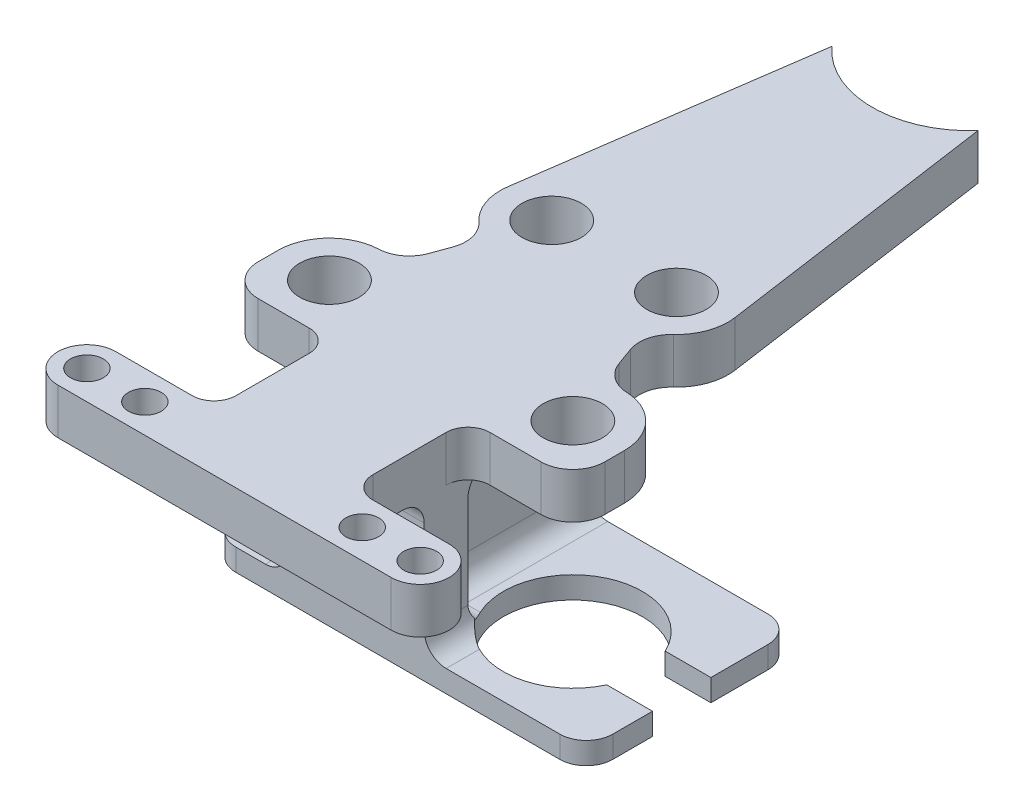
from build123d import *

# Parameters (mm, degrees)
SKETCH1_R           = 3.25
BOSS_EXTRUDE1_DEPTH = 5
SKETCH3_R           = 1.7
BOSS_EXTRUDE2_DEPTH = 2.4
BOSS_EXTRUDE3_REACH = 66.855
SKETCH5_R           = 1.8
BOSS_EXTRUDE4_DEPTH = 5
FILLET1_R           = 2.4
FILLET2_R           = 2.4


with BuildPart() as part:
    # Sketch1 → Boss-Extrude1 (new body)
    with BuildSketch(Plane(origin=(0, 0, 0), x_dir=(1, 0, 0), z_dir=(0, 1, 0))):
        with BuildLine():
            Line((10.443513484, 13.59429391), (9.728103792, 15.559865885))
            ThreePointArc((9.728103792, 15.559865885), (9.617407167, 17.589149357), (10.652936445, 19.337841515))
            ThreePointArc((10.652936445, 19.337841515), (12.155980837, 21.599725149), (12.430058531, 24.30160254))
            Line((12.430058531, 24.30160254), (8, 55.375021057))
            ThreePointArc((8, 55.375021057), (0, 51.788534795), (-8, 55.375021057))
            Line((-8, 55.375021057), (-12.430058531, 24.30160254))
            ThreePointArc((-12.430058531, 24.30160254), (-12.155980837, 21.599725149), (-10.652936445, 19.337841515))
            ThreePointArc((-10.652936445, 19.337841515), (-9.617407167, 17.589149357), (-9.728103792, 15.559865885))
            Line((-9.728103792, 15.559865885), (-10.443513484, 13.59429391))
            ThreePointArc((-10.443513484, 13.59429391), (-11.663113222, 11.968618164), (-13.580412324, 11.294667642))
            ThreePointArc((-13.580412324, 11.294667642), (-17.415997404, 9.557423727), (-18.985, 5.65))
            Line((-18.985, 5.65), (-18.985, 3.5))
            ThreePointArc((-18.985, 3.5), (-17.959873734, 1.025126266), (-15.485, 0))
            Line((-15.485, 0), (15.485, 0))
            ThreePointArc((15.485, 0), (17.959873734, 1.025126266), (18.985, 3.5))
            Line((18.985, 3.5), (18.985, 5.65))
            ThreePointArc((18.985, 5.65), (17.415997404, 9.557423727), (13.580412324, 11.294667642))
            ThreePointArc((13.580412324, 11.294667642), (11.663113222, 11.968618164), (10.443513484, 13.59429391))
        make_face()
        with Locations(Location((6.836617277, 23.504159795, 0), (0, 0, 270))):
            Circle(SKETCH1_R, mode=Mode.SUBTRACT)
        with Locations(Location((13.335, 5.65, 0), (0, 0, 270))):
            Circle(SKETCH1_R, mode=Mode.SUBTRACT)
        with Locations(Location((-13.335, 5.65, 0), (0, 0, 90))):
            Circle(SKETCH1_R, mode=Mode.SUBTRACT)
        with Locations(Location((-6.836617277, 23.504159795, 0), (0, 0, 90))):
            Circle(SKETCH1_R, mode=Mode.SUBTRACT)
    extrude(amount=BOSS_EXTRUDE1_DEPTH)

    # Boss-Extrude3: up to this face of the body (flat: up to its plane)
    boss_extrude3_end = Plane(part.part.faces().sort_by_distance((0, 5, -24.11358482))[0])
    # Sketch4 → Boss-Extrude3 (add, up to the picked face)
    with BuildSketch(Plane.XZ.offset(17.4), mode=Mode.PRIVATE) as boss_extrude3_sk1:
        Polygon((-2.4, 0), (-2.4, -18), (2.4, -18), (2.4, 0), (7.5, 0), (7.5, 4.8), (-7.5, 4.8), (-7.5, 0), align=None)
    boss_extrude3_tool1 = split(extrude(boss_extrude3_sk1.sketch, amount=-BOSS_EXTRUDE3_REACH, mode=Mode.PRIVATE), bisect_by=boss_extrude3_end, keep=Keep.BOTH, mode=Mode.PRIVATE)


with BuildPart() as body_2:
    # Sketch3 → Boss-Extrude2 (new body)
    with BuildSketch(Plane(origin=(0, -15, 0), x_dir=(-1, 0, 0), z_dir=(0, -1, 0))):
        with BuildLine():
            Line((13.14, -4.8), (-22.36, -4.8))
            ThreePointArc((-22.36, -4.8), (-24.410609665, -3.950609665), (-25.26, -1.9))
            Line((-25.26, -1.9), (-25.26, 2.45))
            Line((-25.26, 2.45), (-20.25051878, 2.45))
            ThreePointArc((-20.25051878, 2.45), (-5.715, 5.65), (-20.25051878, 8.85))
            Line((-20.25051878, 8.85), (-25.26, 8.85))
            Line((-25.26, 8.85), (-25.26, 15.1))
            ThreePointArc((-25.26, 15.1), (-24.410609665, 17.150609665), (-22.36, 18))
            Line((-22.36, 18), (-13.335, 18))
            Line((-13.335, 18), (7.22, 18))
            ThreePointArc((7.22, 18), (9.313036072, 17.133036072), (10.18, 15.04))
            ThreePointArc((10.18, 15.04), (11.046963928, 12.946963928), (13.14, 12.08))
            ThreePointArc((13.14, 12.08), (15.190609665, 11.230609665), (16.04, 9.18))
            Line((16.04, 9.18), (16.04, -1.9))
            ThreePointArc((16.04, -1.9), (15.190609665, -3.950609665), (13.14, -4.8))
        make_face()
        with Locations(Location((13.14, 5.65, 0), (0, 0, 90))):
            Circle(SKETCH3_R, mode=Mode.SUBTRACT)
    extrude(amount=BOSS_EXTRUDE2_DEPTH)


with BuildPart() as part_1:
    add(part.part)

    add(body_2.part)  # Boss-Extrude3 merges body 2
    add(boss_extrude3_tool1.solids().sort_by(Axis((0, -17.4, -3.818182), (0, 1, 0)))[0])

    # Sketch5 → Boss-Extrude4 (add)
    with BuildSketch(Plane(origin=(0, 5, 0), x_dir=(1, 0, 0), z_dir=(0, 1, 0))):
        with BuildLine():
            Line((7.5, -12.825), (18.25625, -12.825))
            ThreePointArc((18.25625, -12.825), (21.43125, -16), (18.25625, -19.175))
            Line((18.25625, -19.175), (-18.25625, -19.175))
            ThreePointArc((-18.25625, -19.175), (-21.43125, -16), (-18.25625, -12.825))
            Line((-18.25625, -12.825), (-7.5, -12.825))
            Line((-7.5, -12.825), (-7.5, -4.8))
            Line((-7.5, -4.8), (7.5, -4.8))
            Line((7.5, -4.8), (7.5, -12.825))
        make_face()
        with Locations(Location((18.25625, -16, 0), (0, 0, 270))):
            Circle(SKETCH5_R, mode=Mode.SUBTRACT)
        with Locations(Location((11.90625, -16, 0), (0, 0, 270))):
            Circle(SKETCH5_R, mode=Mode.SUBTRACT)
        with Locations(Location((-11.90625, -16, 0), (0, 0, 270))):
            Circle(SKETCH5_R, mode=Mode.SUBTRACT)
        with Locations(Location((-18.25625, -16, 0), (0, 0, 270))):
            Circle(SKETCH5_R, mode=Mode.SUBTRACT)
    extrude(amount=-BOSS_EXTRUDE4_DEPTH)

    # Fillet1
    # the kernel refuses this fillet: 2.4 mm, written as the material it adds along each edge
    with BuildSketch(Plane(origin=(-4.8, -12.6, -2.4), x_dir=(1, 0, 0), z_dir=(0, -1, 0))) as fillet1_piece_1_section:
        Polygon((0, 0), (FILLET1_R * 1.02, 0), (FILLET1_R * 1.02, FILLET1_R * 1.02), (0, FILLET1_R * 1.02), align=None)
    fillet1_piece_1 = extrude(amount=FILLET1_R * 1.02, mode=Mode.PRIVATE)
    fillet1_piece_1 = fillet1_piece_1 - Plane(origin=(-4.8, -12.6, -2.4), x_dir=(-0.7071067811865477, 0, -0.7071067811865474), z_dir=(0, -1, 0)) * Sphere(FILLET1_R, mode=Mode.PRIVATE)
    add(fillet1_piece_1)
    with BuildSketch(Plane(origin=(4.8, -12.6, -2.4), x_dir=(0, 0, 1), z_dir=(-1, 0, 0))) as fillet1_piece_2_section:
        Polygon((0, 0), (FILLET1_R * 1.02, 0), (FILLET1_R * 1.02, -FILLET1_R * 1.02), (0, -FILLET1_R * 1.02), align=None)
    fillet1_piece_2 = extrude(amount=FILLET1_R * 1.02, mode=Mode.PRIVATE)
    fillet1_piece_2 = fillet1_piece_2 - Plane(origin=(4.8, -12.6, -2.4), x_dir=(0, 0.7071067811865475, -0.7071067811865475), z_dir=(-1, 0, 0)) * Sphere(FILLET1_R, mode=Mode.PRIVATE)
    add(fillet1_piece_2)
    with BuildSketch(Plane(origin=(2.4, 0, 0), x_dir=(1, 0, 0), z_dir=(0, 0, -1)), Plane(origin=(-2.4, 0, -18), x_dir=(-1, 0, 0), z_dir=(0, 0, 1))) as fillet1_piece_3:
        with BuildLine():
            CenterArc((FILLET1_R, FILLET1_R), FILLET1_R, 180, 90)
            Line((0, FILLET1_R), (-FILLET1_R * 0.02, FILLET1_R))
            Line((-FILLET1_R * 0.02, FILLET1_R), (-FILLET1_R * 0.02, -FILLET1_R * 0.02))
            Line((-FILLET1_R * 0.02, -FILLET1_R * 0.02), (FILLET1_R, -FILLET1_R * 0.02))
            Line((FILLET1_R, -FILLET1_R * 0.02), (FILLET1_R, 0))
        make_face()
    extrude(amount=18)
    with BuildSketch(Plane(origin=(-2.4, -12.6, 0), x_dir=(-1, 0, 0), z_dir=(0, 1, 0)), Plane(origin=(2.4, -12.6, 0), x_dir=(0, 0, -1), z_dir=(0, 1, 0))) as fillet1_piece_4:
        with BuildLine():
            CenterArc((FILLET1_R, -FILLET1_R), FILLET1_R, 90, 90)
            Line((0, -FILLET1_R), (-FILLET1_R * 0.02, -FILLET1_R))
            Line((-FILLET1_R * 0.02, -FILLET1_R), (-FILLET1_R * 0.02, FILLET1_R * 0.02))
            Line((-FILLET1_R * 0.02, FILLET1_R * 0.02), (FILLET1_R, FILLET1_R * 0.02))
            Line((FILLET1_R, FILLET1_R * 0.02), (FILLET1_R, 0))
        make_face()
    extrude(amount=12.6)
    with BuildSketch(Plane(origin=(-7.5, 0, 0), x_dir=(-1, 0, 0), z_dir=(0, 1, 0))) as fillet1_piece_5_section:
        with BuildLine():
            CenterArc((FILLET1_R, FILLET1_R), FILLET1_R, 180, 90)
            Line((0, FILLET1_R), (-FILLET1_R * 0.02, FILLET1_R))
            Line((-FILLET1_R * 0.02, FILLET1_R), (-FILLET1_R * 0.02, -FILLET1_R * 0.02))
            Line((-FILLET1_R * 0.02, -FILLET1_R * 0.02), (FILLET1_R, -FILLET1_R * 0.02))
            Line((FILLET1_R, -FILLET1_R * 0.02), (FILLET1_R, 0))
        make_face()
    fillet1_piece_5 = extrude(amount=5, mode=Mode.PRIVATE)
    fillet1_piece_5 = split(fillet1_piece_5, bisect_by=Plane(origin=(-7.988335511, 2.5, 0), z_dir=(0, 0, 1)), keep=Keep.TOP, mode=Mode.PRIVATE)
    add(fillet1_piece_5)
    with BuildSketch(Plane(origin=(7.5, 5, 12.825), x_dir=(1, 0, 0), z_dir=(0, -1, 0))) as fillet1_piece_6:
        with BuildLine():
            CenterArc((FILLET1_R, -FILLET1_R), FILLET1_R, 90, 90)
            Line((0, -FILLET1_R), (-FILLET1_R * 0.02, -FILLET1_R))
            Line((-FILLET1_R * 0.02, -FILLET1_R), (-FILLET1_R * 0.02, FILLET1_R * 0.02))
            Line((-FILLET1_R * 0.02, FILLET1_R * 0.02), (FILLET1_R, FILLET1_R * 0.02))
            Line((FILLET1_R, FILLET1_R * 0.02), (FILLET1_R, 0))
        make_face()
    extrude(amount=5)
    with BuildSketch(Plane(origin=(7.5, 0, 0), x_dir=(1, 0, 0), z_dir=(0, 1, 0))) as fillet1_piece_7_section:
        with BuildLine():
            CenterArc((FILLET1_R, -FILLET1_R), FILLET1_R, 90, 90)
            Line((0, -FILLET1_R), (-FILLET1_R * 0.02, -FILLET1_R))
            Line((-FILLET1_R * 0.02, -FILLET1_R), (-FILLET1_R * 0.02, FILLET1_R * 0.02))
            Line((-FILLET1_R * 0.02, FILLET1_R * 0.02), (FILLET1_R, FILLET1_R * 0.02))
            Line((FILLET1_R, FILLET1_R * 0.02), (FILLET1_R, 0))
        make_face()
    fillet1_piece_7 = extrude(amount=5, mode=Mode.PRIVATE)
    fillet1_piece_7 = split(fillet1_piece_7, bisect_by=Plane(origin=(7.988335511, 2.5, 0), z_dir=(0, 0, 1)), keep=Keep.TOP, mode=Mode.PRIVATE)
    add(fillet1_piece_7)
    with BuildSketch(Plane(origin=(-7.5, 5, 12.825), x_dir=(-1, 0, 0), z_dir=(0, -1, 0))) as fillet1_piece_8:
        with BuildLine():
            CenterArc((FILLET1_R, FILLET1_R), FILLET1_R, 180, 90)
            Line((0, FILLET1_R), (-FILLET1_R * 0.02, FILLET1_R))
            Line((-FILLET1_R * 0.02, FILLET1_R), (-FILLET1_R * 0.02, -FILLET1_R * 0.02))
            Line((-FILLET1_R * 0.02, -FILLET1_R * 0.02), (FILLET1_R, -FILLET1_R * 0.02))
            Line((FILLET1_R, -FILLET1_R * 0.02), (FILLET1_R, 0))
        make_face()
    extrude(amount=5)
    with BuildSketch(Plane(origin=(2.4, -15, -2.4), x_dir=(1, 0, 0), z_dir=(0, 0, -1))) as fillet1_piece_9:
        with BuildLine():
            CenterArc((FILLET1_R, -FILLET1_R), FILLET1_R, 90, 90)
            Line((0, -FILLET1_R), (-FILLET1_R * 0.02, -FILLET1_R))
            Line((-FILLET1_R * 0.02, -FILLET1_R), (-FILLET1_R * 0.02, FILLET1_R * 0.02))
            Line((-FILLET1_R * 0.02, FILLET1_R * 0.02), (FILLET1_R, FILLET1_R * 0.02))
            Line((FILLET1_R, FILLET1_R * 0.02), (FILLET1_R, 0))
        make_face()
    extrude(amount=15.6)
    with BuildSketch(Plane(origin=(-7.5, -15, 0), x_dir=(0, 1, 0), z_dir=(0, 0, 1))) as fillet1_piece_10:
        with BuildLine():
            CenterArc((FILLET1_R, FILLET1_R), FILLET1_R, 180, 90)
            Line((0, FILLET1_R), (-FILLET1_R * 0.02, FILLET1_R))
            Line((-FILLET1_R * 0.02, FILLET1_R), (-FILLET1_R * 0.02, -FILLET1_R * 0.02))
            Line((-FILLET1_R * 0.02, -FILLET1_R * 0.02), (FILLET1_R, -FILLET1_R * 0.02))
            Line((FILLET1_R, -FILLET1_R * 0.02), (FILLET1_R, 0))
        make_face()
    extrude(amount=4.8)
    with BuildSketch(Plane(origin=(-2.4, -15, -18), x_dir=(0, 1, 0), z_dir=(0, 0, 1))) as fillet1_piece_11:
        with BuildLine():
            CenterArc((FILLET1_R, FILLET1_R), FILLET1_R, 180, 90)
            Line((0, FILLET1_R), (-FILLET1_R * 0.02, FILLET1_R))
            Line((-FILLET1_R * 0.02, FILLET1_R), (-FILLET1_R * 0.02, -FILLET1_R * 0.02))
            Line((-FILLET1_R * 0.02, -FILLET1_R * 0.02), (FILLET1_R, -FILLET1_R * 0.02))
            Line((FILLET1_R, -FILLET1_R * 0.02), (FILLET1_R, 0))
        make_face()
    extrude(amount=15.6)
    with BuildSketch(Plane(origin=(-4.8, -15, 0), x_dir=(0, 1, 0), z_dir=(-1, 0, 0))) as fillet1_piece_12:
        with BuildLine():
            CenterArc((FILLET1_R, FILLET1_R), FILLET1_R, 180, 90)
            Line((0, FILLET1_R), (-FILLET1_R * 0.02, FILLET1_R))
            Line((-FILLET1_R * 0.02, FILLET1_R), (-FILLET1_R * 0.02, -FILLET1_R * 0.02))
            Line((-FILLET1_R * 0.02, -FILLET1_R * 0.02), (FILLET1_R, -FILLET1_R * 0.02))
            Line((FILLET1_R, -FILLET1_R * 0.02), (FILLET1_R, 0))
        make_face()
    extrude(amount=2.7)
    with BuildSketch(Plane(origin=(7.5, -15, 0), x_dir=(0, 0, -1), z_dir=(-1, 0, 0))) as fillet1_piece_13_section:
        with BuildLine():
            CenterArc((FILLET1_R, -FILLET1_R), FILLET1_R, 90, 90)
            Line((0, -FILLET1_R), (-FILLET1_R * 0.02, -FILLET1_R))
            Line((-FILLET1_R * 0.02, -FILLET1_R), (-FILLET1_R * 0.02, FILLET1_R * 0.02))
            Line((-FILLET1_R * 0.02, FILLET1_R * 0.02), (FILLET1_R, FILLET1_R * 0.02))
            Line((FILLET1_R, FILLET1_R * 0.02), (FILLET1_R, 0))
        make_face()
    fillet1_piece_13 = extrude(amount=2.7, mode=Mode.PRIVATE)
    fillet1_piece_13 = fillet1_piece_13 - Plane(origin=(13.335, -14.438694291, -5.65), x_dir=(0.9075483963583585, 0, 0.4199475065616797), z_dir=(0, 1, 0)) * Cylinder(7.62, 16, mode=Mode.PRIVATE)
    add(fillet1_piece_13)
    with BuildSketch(Plane(origin=(2.4, 0, 6), x_dir=(1, 0, 0), z_dir=(0, 0, -1))) as fillet1_piece_14a_section:
        with BuildLine():
            CenterArc((FILLET1_R, FILLET1_R), FILLET1_R, 180, 90)
            Line((0, FILLET1_R), (-FILLET1_R * 0.02, FILLET1_R))
            Line((-FILLET1_R * 0.02, FILLET1_R), (-FILLET1_R * 0.02, -FILLET1_R * 0.02))
            Line((-FILLET1_R * 0.02, -FILLET1_R * 0.02), (FILLET1_R, -FILLET1_R * 0.02))
            Line((FILLET1_R, -FILLET1_R * 0.02), (FILLET1_R, 0))
        make_face()
    fillet1_piece_14a = extrude(amount=24, mode=Mode.PRIVATE)
    fillet1_piece_14a = split(fillet1_piece_14a, bisect_by=Plane(origin=(2.943348274, -0.543348274, 0), z_dir=(0, 0, 1)), keep=Keep.TOP, mode=Mode.PRIVATE)
    with BuildSketch(Plane(origin=(2.4, -12.6, 0), x_dir=(0, 0, -1), z_dir=(0, 1, 0))) as fillet1_piece_14b_section:
        with BuildLine():
            CenterArc((FILLET1_R, -FILLET1_R), FILLET1_R, 90, 90)
            Line((0, -FILLET1_R), (-FILLET1_R * 0.02, -FILLET1_R))
            Line((-FILLET1_R * 0.02, -FILLET1_R), (-FILLET1_R * 0.02, FILLET1_R * 0.02))
            Line((-FILLET1_R * 0.02, FILLET1_R * 0.02), (FILLET1_R, FILLET1_R * 0.02))
            Line((FILLET1_R, FILLET1_R * 0.02), (FILLET1_R, 0))
        make_face()
    fillet1_piece_14b = extrude(amount=18.6, mode=Mode.PRIVATE)
    fillet1_piece_14b = split(fillet1_piece_14b, bisect_by=Plane(origin=(2.943348274, 0, -0.543348274), z_dir=(0, 1, 0)), keep=Keep.TOP, mode=Mode.PRIVATE)
    fillet1_piece_14 = fillet1_piece_14a & fillet1_piece_14b
    add(fillet1_piece_14)
    with BuildSketch(Plane(origin=(-2.4, 0, -18), x_dir=(-1, 0, 0), z_dir=(0, 0, 1))) as fillet1_piece_15a_section:
        with BuildLine():
            CenterArc((FILLET1_R, FILLET1_R), FILLET1_R, 180, 90)
            Line((0, FILLET1_R), (-FILLET1_R * 0.02, FILLET1_R))
            Line((-FILLET1_R * 0.02, FILLET1_R), (-FILLET1_R * 0.02, -FILLET1_R * 0.02))
            Line((-FILLET1_R * 0.02, -FILLET1_R * 0.02), (FILLET1_R, -FILLET1_R * 0.02))
            Line((FILLET1_R, -FILLET1_R * 0.02), (FILLET1_R, 0))
        make_face()
    fillet1_piece_15a = extrude(amount=24, mode=Mode.PRIVATE)
    fillet1_piece_15a = split(fillet1_piece_15a, bisect_by=Plane(origin=(-2.943348274, -0.543348274, 0), z_dir=(0, 0, 1)), keep=Keep.TOP, mode=Mode.PRIVATE)
    with BuildSketch(Plane(origin=(-2.4, -12.6, 0), x_dir=(-1, 0, 0), z_dir=(0, 1, 0))) as fillet1_piece_15b_section:
        with BuildLine():
            CenterArc((FILLET1_R, -FILLET1_R), FILLET1_R, 90, 90)
            Line((0, -FILLET1_R), (-FILLET1_R * 0.02, -FILLET1_R))
            Line((-FILLET1_R * 0.02, -FILLET1_R), (-FILLET1_R * 0.02, FILLET1_R * 0.02))
            Line((-FILLET1_R * 0.02, FILLET1_R * 0.02), (FILLET1_R, FILLET1_R * 0.02))
            Line((FILLET1_R, FILLET1_R * 0.02), (FILLET1_R, 0))
        make_face()
    fillet1_piece_15b = extrude(amount=18.6, mode=Mode.PRIVATE)
    fillet1_piece_15b = split(fillet1_piece_15b, bisect_by=Plane(origin=(-2.943348274, 0, -0.543348274), z_dir=(0, 1, 0)), keep=Keep.TOP, mode=Mode.PRIVATE)
    fillet1_piece_15 = fillet1_piece_15a & fillet1_piece_15b
    add(fillet1_piece_15)
    with BuildSketch(Plane(origin=(-4.8, -15, 0), x_dir=(0, 1, 0), z_dir=(-1, 0, 0))) as fillet1_piece_16a_section:
        with BuildLine():
            CenterArc((FILLET1_R, FILLET1_R), FILLET1_R, 180, 90)
            Line((0, FILLET1_R), (-FILLET1_R * 0.02, FILLET1_R))
            Line((-FILLET1_R * 0.02, FILLET1_R), (-FILLET1_R * 0.02, -FILLET1_R * 0.02))
            Line((-FILLET1_R * 0.02, -FILLET1_R * 0.02), (FILLET1_R, -FILLET1_R * 0.02))
            Line((FILLET1_R, -FILLET1_R * 0.02), (FILLET1_R, 0))
        make_face()
    fillet1_piece_16a = extrude(amount=8.7, mode=Mode.PRIVATE)
    fillet1_piece_16a = split(fillet1_piece_16a, bisect_by=Plane(origin=(-7.5, -14.456651726, -0.543348274), z_dir=(-1, 0, 0)), keep=Keep.TOP, mode=Mode.PRIVATE)
    with BuildSketch(Plane(origin=(-7.5, -15, -6), x_dir=(0, 1, 0), z_dir=(0, 0, 1))) as fillet1_piece_16b_section:
        with BuildLine():
            CenterArc((FILLET1_R, FILLET1_R), FILLET1_R, 180, 90)
            Line((0, FILLET1_R), (-FILLET1_R * 0.02, FILLET1_R))
            Line((-FILLET1_R * 0.02, FILLET1_R), (-FILLET1_R * 0.02, -FILLET1_R * 0.02))
            Line((-FILLET1_R * 0.02, -FILLET1_R * 0.02), (FILLET1_R, -FILLET1_R * 0.02))
            Line((FILLET1_R, -FILLET1_R * 0.02), (FILLET1_R, 0))
        make_face()
    fillet1_piece_16b = extrude(amount=10.8, mode=Mode.PRIVATE)
    fillet1_piece_16b = split(fillet1_piece_16b, bisect_by=Plane(origin=(-8.043348274, -14.456651726, 0), z_dir=(0, 0, -1)), keep=Keep.TOP, mode=Mode.PRIVATE)
    fillet1_piece_16 = fillet1_piece_16a & fillet1_piece_16b
    add(fillet1_piece_16)

    # Fillet2
    # the kernel refuses this fillet: 2.4 mm, written as the material it adds along each edge
    with BuildSketch(Plane(origin=(4.8, -2.4, -2.4), x_dir=(0, 0, 1), z_dir=(0, 1, 0))) as fillet2_piece_1_section:
        Polygon((0, 0), (FILLET2_R * 1.02, 0), (FILLET2_R * 1.02, -FILLET2_R * 1.02), (0, -FILLET2_R * 1.02), align=None)
    fillet2_piece_1 = extrude(amount=FILLET2_R * 1.02, mode=Mode.PRIVATE)
    fillet2_piece_1 = fillet2_piece_1 - Plane(origin=(4.8, -2.4, -2.4), x_dir=(0.7071067811865479, 0, -0.7071067811865471), z_dir=(0, 1, 0)) * Sphere(FILLET2_R, mode=Mode.PRIVATE)
    add(fillet2_piece_1)
    with BuildSketch(Plane(origin=(-4.8, -2.4, -2.4), x_dir=(0, 0, 1), z_dir=(0, 1, 0))) as fillet2_piece_2_section:
        Polygon((0, 0), (FILLET2_R * 1.02, 0), (FILLET2_R * 1.02, FILLET2_R * 1.02), (0, FILLET2_R * 1.02), align=None)
    fillet2_piece_2 = extrude(amount=FILLET2_R * 1.02, mode=Mode.PRIVATE)
    fillet2_piece_2 = fillet2_piece_2 - Plane(origin=(-4.8, -2.4, -2.4), x_dir=(-0.7071067811865477, 0, -0.7071067811865474), z_dir=(0, 1, 0)) * Sphere(FILLET2_R, mode=Mode.PRIVATE)
    add(fillet2_piece_2)
    with BuildSketch(Plane(origin=(7.5, 0, 0), x_dir=(0, 0, -1), z_dir=(-1, 0, 0)), Plane(origin=(-4.8, 0, 0), x_dir=(0, 0, -1), z_dir=(-1, 0, 0))) as fillet2_piece_3:
        with BuildLine():
            CenterArc((FILLET2_R, FILLET2_R), FILLET2_R, 180, 90)
            Line((0, FILLET2_R), (0, 0))
            Line((0, 0), (FILLET2_R, 0))
        make_face()
    extrude(amount=2.7)
    with BuildSketch(Plane(origin=(-7.5, 0, 4.8), x_dir=(0, 0, 1), z_dir=(1, 0, 0))) as fillet2_piece_4:
        with BuildLine():
            CenterArc((FILLET2_R, FILLET2_R), FILLET2_R, 180, 90)
            Line((0, FILLET2_R), (0, 0))
            Line((0, 0), (FILLET2_R, 0))
        make_face()
    extrude(amount=15)
    with BuildSketch(Plane(origin=(7.5, -15, 4.8), x_dir=(1, 0, 0), z_dir=(0, 0, -1))) as fillet2_piece_5_section:
        with BuildLine():
            CenterArc((FILLET2_R, -FILLET2_R), FILLET2_R, 90, 90)
            Line((0, -FILLET2_R), (0, 0))
            Line((0, 0), (FILLET2_R, 0))
        make_face()
    fillet2_piece_5 = extrude(amount=11.549267912, mode=Mode.PRIVATE)
    fillet2_piece_5 = fillet2_piece_5 - Plane(origin=(8.019316214, -12.6, -2.4), x_dir=(0, 0, -1), z_dir=(1, 0, 0)) * Cylinder(2.4, 33, mode=Mode.PRIVATE)
    fillet2_piece_5 = fillet2_piece_5 - Plane(origin=(13.335, -14.455757627, -5.65), x_dir=(0.9075483963581732, 0, 0.41994750656208013), z_dir=(0, 1, 0)) * Cylinder(7.62, 33, mode=Mode.PRIVATE)
    add(fillet2_piece_5)


solid = part_1.part
